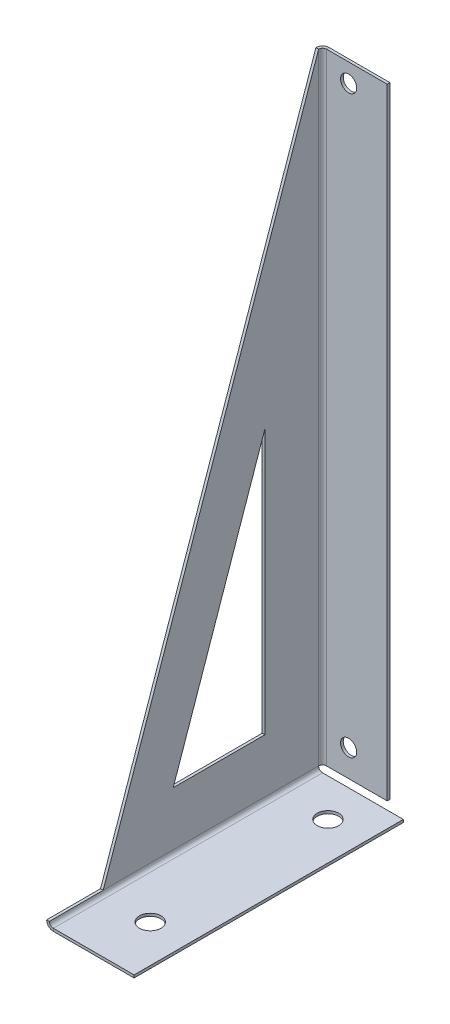
from build123d import *

# Parameters (mm, degrees)
SKETCH2_W          = 15
SKETCH2_H          = 50
BASE_FLANGE1_DEPTH = 0.5
EDGE_FLANGE1_DEPTH = 50
CUT_EXTRUDE1_DEPTH = 10
EDGE_FLANGE2_DEPTH = 115.2634
CUT_EXTRUDE2_DEPTH = 10
SKETCH13_R         = 1.5
CUT_EXTRUDE3_DEPTH = 10
SKETCH14_R         = 1.5
CUT_EXTRUDE4_DEPTH = 10
SKETCH15_R         = 2
CUT_EXTRUDE5_DEPTH = 12
SKETCH16_R         = 2
CUT_EXTRUDE6_DEPTH = 12


# Sheet-metal steps are written as plain solids
with BuildPart() as part:
    # Sketch2 → Base-Flange1 (new body)
    with BuildSketch(Plane(origin=(0, 0, 0), x_dir=(1, 0, 0), z_dir=(0, 1, 0))):
        with Locations((-7.5, -25)):
            Rectangle(SKETCH2_W, SKETCH2_H)
    extrude(amount=-BASE_FLANGE1_DEPTH)

    # Edge-Flange1 section (across the edge) → Edge-Flange1 (add)
    with BuildSketch(Plane(origin=(-15.7366, 0, 0), x_dir=(1, 0, 0), z_dir=(0, 0, 1))):
        with BuildLine():
            Line((-0.5, 0.7366), (-0.5, 116))
            Line((-0.5, 116), (0, 116))
            Line((0, 116), (0, 0.7366))
            ThreePointArc((0, 0.7366), (0.215745145, 0.215745145), (0.7366, 0))
            Line((0.7366, 0), (0.7366, -0.5))
            ThreePointArc((0.7366, -0.5), (-0.137808246, -0.137808246), (-0.5, 0.7366))
        make_face()
    extrude(amount=EDGE_FLANGE1_DEPTH)

    # Sketch8 → Cut-Extrude1 (cut)
    with BuildSketch(Plane.ZY.offset(16.2366)):
        Polygon((40, 0.7366), (0, 116), (50, 116), (50, 0.7366), align=None)
    extrude(amount=-CUT_EXTRUDE1_DEPTH, mode=Mode.SUBTRACT)

    # Edge-Flange2 section (across the edge) → Edge-Flange2 (add)
    with BuildSketch(Plane(origin=(-15.7366, 0.7366, -0.7366), x_dir=(0, 0, 1), z_dir=(0, 1, 0))):
        with BuildLine():
            Line((-0.5, 0.7366), (-0.5, 12))
            Line((-0.5, 12), (0, 12))
            Line((0, 12), (0, 0.7366))
            ThreePointArc((0, 0.7366), (0.215745145, 0.215745145), (0.7366, 0))
            Line((0.7366, 0), (0.7366, -0.5))
            ThreePointArc((0.7366, -0.5), (-0.137808246, -0.137808246), (-0.5, 0.7366))
        make_face()
    extrude(amount=EDGE_FLANGE2_DEPTH)

    # Sketch12 → Cut-Extrude2 (cut)
    with BuildSketch(Plane.ZY.offset(16.2366)):
        Polygon((10, 59.851091606), (27, 10.7366), (10, 10.7366), align=None)
    extrude(amount=-CUT_EXTRUDE2_DEPTH, mode=Mode.SUBTRACT)

    # Sketch13 → Cut-Extrude3 (cut)
    with BuildSketch(Plane(origin=(0, 0, -1.2366), x_dir=(-1, 0, 0), z_dir=(0, 0, -1))):
        with Locations((10.9, 5.7366)):
            Circle(SKETCH13_R)
    extrude(amount=-CUT_EXTRUDE3_DEPTH, mode=Mode.SUBTRACT)

    # Sketch14 → Cut-Extrude4 (cut)
    with BuildSketch(Plane.XY.offset(-0.7366)):
        with Locations((-10.9, 112.5366)):
            Circle(SKETCH14_R)
    extrude(amount=-CUT_EXTRUDE4_DEPTH, mode=Mode.SUBTRACT)

    # Sketch15 → Cut-Extrude5 (cut)
    with BuildSketch(Plane(origin=(0, 0, 0), x_dir=(1, 0, 0), z_dir=(0, 1, 0))):
        with Locations(Location((-7, -40, 0), (0, 0, 270))):
            Circle(SKETCH15_R)
    extrude(amount=-CUT_EXTRUDE5_DEPTH, mode=Mode.SUBTRACT)

    # Sketch16 → Cut-Extrude6 (cut)
    with BuildSketch(Plane(origin=(0, 0, 0), x_dir=(1, 0, 0), z_dir=(0, 1, 0))):
        with Locations(Location((-7, -7, 0), (0, 0, 270))):
            Circle(SKETCH16_R)
    extrude(amount=-CUT_EXTRUDE6_DEPTH, mode=Mode.SUBTRACT)


solid = part.part
